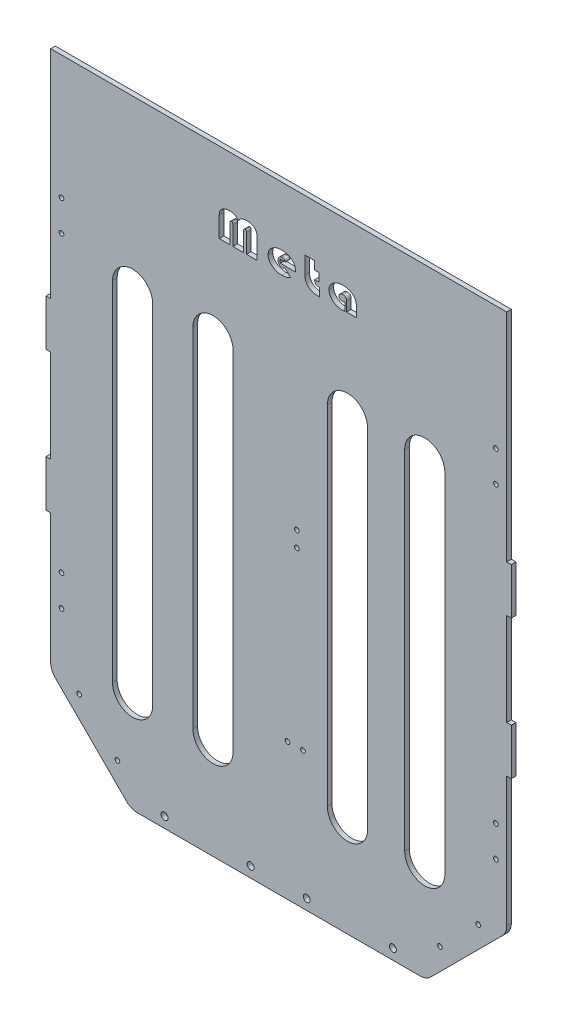
from build123d import *

# Parameters (mm, degrees)
EXTRUDE_1_DEPTH     = 3
CUT_EXTRUDE_2_DEPTH = 228.06662018
SKETCH_2_R          = 1.5
SKETCH_2_R_2        = 2.25
CUT_EXTRUDE_1_DEPTH = 10
SKETCH_4_R          = 1.5
CUT_EXTRUDE_3_DEPTH = 228.06662018
CUT_EXTRUDE_4_DEPTH = 228.06662018
FILLET_3_R          = 10
SKETCH_8_R          = 1.5
CUT_EXTRUDE_5_DEPTH = 228.06662018
SKETCH_9_W          = 295
SKETCH_9_H          = 60
EXTRUDE_2_DEPTH     = 3
SKETCH_10_R         = 1.5
CUT_EXTRUDE_6_DEPTH = 10
CUT_EXTRUDE_7_DEPTH = 10


with BuildPart() as part:
    # 草图1 → 凸台-拉伸1 (new body)
    with BuildSketch(Plane.XY):
        Polygon((-147.5, 90), (-150.5, 90), (-150.5, 60), (-147.5, 60), (-147.5, 0), (-150.5, 0), (-150.5, -30), (-147.5, -30), (-147.5, -90), (-147.5, -120), (-147.5, -170), (147.5, -170), (147.5, -120), (147.5, -90), (147.5, -30), (150.5, -30), (150.5, 0), (147.5, 0), (147.5, 60), (150.5, 60), (150.5, 90), (147.5, 90), (147.5, 170), (-147.5, 170), align=None)
    extrude(amount=EXTRUDE_1_DEPTH)

    # 草图3 → 切除-拉伸2 (cut, through all)
    with BuildSketch(Plane.XY.offset(3)):
        Polygon((-147.5, -118), (-95.5, -170), (-147.5, -170), align=None)
        Polygon((147.5, -170), (147.5, -118), (95.5, -170), align=None)
    extrude(amount=-CUT_EXTRUDE_2_DEPTH, mode=Mode.SUBTRACT)

    # 草图2 → 切除-拉伸1 (cut)
    with BuildSketch(Plane.XY.offset(3)):
        with Locations((11.800454572, 40)):
            Circle(SKETCH_2_R)
        with Locations((11.800454572, 30)):
            Circle(SKETCH_2_R)
        with Locations((-73.85, -163.15)):
            Circle(SKETCH_2_R_2)
        with Locations((-18.15, -163.15)):
            Circle(SKETCH_2_R_2)
        with Locations((18.15, -163.15)):
            Circle(SKETCH_2_R_2)
        with Locations((73.85, -163.15)):
            Circle(SKETCH_2_R_2)
    extrude(amount=-CUT_EXTRUDE_1_DEPTH, mode=Mode.SUBTRACT)

    # 草图4 → 切除-拉伸3 (cut, through all)
    with BuildSketch(Plane.XY.offset(3)):
        with Locations((140.5, 150)):
            Circle(SKETCH_4_R)
        with Locations((140.5, 130)):
            Circle(SKETCH_4_R)
        with Locations((140.5, -60)):
            Circle(SKETCH_4_R)
        with Locations((140.5, -80)):
            Circle(SKETCH_4_R)
        with Locations((-140.5, -80)):
            Circle(SKETCH_4_R)
        with Locations((-140.5, -60)):
            Circle(SKETCH_4_R)
        with Locations((-140.5, 130)):
            Circle(SKETCH_4_R)
        with Locations((-140.5, 150)):
            Circle(SKETCH_4_R)
    extrude(amount=-CUT_EXTRUDE_3_DEPTH, mode=Mode.SUBTRACT)

    # 草图5 → 切除-拉伸4 (cut, through all)
    with BuildSketch(Plane.XY.offset(3)):
        with BuildLine():
            Line((-81.5, 120), (-81.5, -105))
            ThreePointArc((-81.5, -105), (-94.5, -118), (-107.5, -105))
            Line((-107.5, -105), (-107.5, 120))
            ThreePointArc((-107.5, 120), (-94.5, 133), (-81.5, 120))
        make_face()
        with BuildLine():
            Line((-29.5, 120), (-29.5, -105))
            ThreePointArc((-29.5, -105), (-42.5, -118), (-55.5, -105))
            Line((-55.5, -105), (-55.5, 120))
            ThreePointArc((-55.5, 120), (-42.5, 133), (-29.5, 120))
        make_face()
        with BuildLine():
            Line((57.5, 120), (57.5, -105))
            ThreePointArc((57.5, -105), (44.5, -118), (31.5, -105))
            Line((31.5, -105), (31.5, 120))
            ThreePointArc((31.5, 120), (44.5, 133), (57.5, 120))
        make_face()
        with BuildLine():
            Line((107.5, 120), (107.5, -105))
            ThreePointArc((107.5, -105), (94.5, -118), (81.5, -105))
            Line((81.5, -105), (81.5, 120))
            ThreePointArc((81.5, 120), (94.5, 133), (107.5, 120))
        make_face()
    extrude(amount=-CUT_EXTRUDE_4_DEPTH, mode=Mode.SUBTRACT)

    # 圆角3
    fillet_3_edges = [part.edges().sort_by_distance(p)[0] for p in [
        (147.5, -118, 1.5),
        (95.5, -170, 1.5),
        (-95.5, -170, 1.5),
        (-147.5, -118, 1.5),
    ]]
    fillet(fillet_3_edges, radius=FILLET_3_R)

    # 草图8 → 切除-拉伸5 (cut, through all)
    with BuildSketch(Plane.XY.offset(3)):
        with Locations((-129.044105664, -122.313758713)):
            Circle(SKETCH_8_R)
        with Locations((-104.295368322, -147.062496054)):
            Circle(SKETCH_8_R)
        with Locations((104.295368322, -147.062496054)):
            Circle(SKETCH_8_R)
        with Locations((129.044105664, -122.313758713)):
            Circle(SKETCH_8_R)
    extrude(amount=-CUT_EXTRUDE_5_DEPTH, mode=Mode.SUBTRACT)

    # 草图9 → 凸台-拉伸2 (add)
    with BuildSketch(Plane.XY.offset(3)):
        with Locations((0, 200)):
            Rectangle(SKETCH_9_W, SKETCH_9_H)
    extrude(amount=-EXTRUDE_2_DEPTH)

    # 草图10 → 切除-拉伸6 (cut)
    with BuildSketch(Plane(origin=(0, 0, 0), x_dir=(-1, 0, 0), z_dir=(0, 0, -1))):
        with Locations((-15.714480525, -81.497694715)):
            Circle(SKETCH_10_R)
        with Locations((-5.714480525, -81.497694715)):
            Circle(SKETCH_10_R)
    extrude(amount=-CUT_EXTRUDE_6_DEPTH, mode=Mode.SUBTRACT)

    # 草图12 → 切除-拉伸7 (cut)
    with BuildSketch(Plane.XY.offset(3)):
        with BuildLine():
            Line((-38.459270455, 178.142606867), (-38.459270455, 191.48003622))
            add(Edge.make_bspline(
                [(-38.459270455, 191.48003622), (-38.455033411, 191.681058058), (-38.446709584, 192.075972675), (-38.346599974, 192.652647807), (-38.208715022, 193.205847545), (-37.99443122, 193.725817353), (-37.730436968, 194.22146777), (-37.396648893, 194.680992182), (-37.014003649, 195.120623841), (-36.567844802, 195.521180351), (-36.079300876, 195.888824271), (-35.54992644, 196.206329747), (-34.989033735, 196.477067178), (-34.392513082, 196.697756907), (-33.761395822, 196.869228712), (-33.096340243, 196.994280016), (-32.397190688, 197.066282213), (-31.919749742, 197.07520164), (-31.676234956, 197.07975092)],
                knots=[0, 0, 0, 0, 0.978236146, 1.921780028, 2.844563154, 3.750638742, 4.654252005, 5.574363863, 6.511385916, 7.48903622, 8.489661905, 9.486229015, 10.491445866, 11.520012641, 12.580453885, 13.674150294, 14.813719686, 16, 16, 16, 16], degree=3))
            add(Edge.make_bspline(
                [(-31.676234956, 197.07975092), (-31.385549048, 197.073097088), (-30.820070313, 197.06015322), (-29.99936011, 196.929275852), (-29.228647015, 196.734183589), (-28.5105693, 196.4454009), (-27.844924771, 196.074455011), (-27.231400107, 195.622132358), (-26.670586716, 195.087898147), (-26.348532633, 194.679853549), (-26.184824194, 194.472433903)],
                knots=[0, 0, 0, 0, 1.102097073, 2.143937636, 3.145610596, 4.113155461, 5.071599259, 6.029492362, 6.998339889, 8, 8, 8, 8], degree=3))
            add(Edge.make_bspline(
                [(-26.184824194, 194.472433903), (-26.009496825, 194.688435518), (-25.666410016, 195.111115131), (-25.074517517, 195.652462415), (-24.448746168, 196.10982807), (-23.770022718, 196.473582165), (-23.028307523, 196.746635702), (-22.214259021, 196.942877484), (-21.321099271, 197.0576227), (-20.699104066, 197.072193956), (-20.376524133, 197.07975092)],
                knots=[0, 0, 0, 0, 1.006073283, 1.968719849, 2.894482347, 3.806317825, 4.746885426, 5.748441048, 6.832293675, 8, 8, 8, 8], degree=3))
            add(Edge.make_bspline(
                [(-20.376524133, 197.07975092), (-20.123647833, 197.07530343), (-19.631518827, 197.066648057), (-18.915021362, 196.994629219), (-18.244107006, 196.871219331), (-17.618314213, 196.698736696), (-17.038228497, 196.479322271), (-16.504642257, 196.208600824), (-16.014321938, 195.890905499), (-15.573399332, 195.519869728), (-15.176511521, 195.107082453), (-14.838764322, 194.643329349), (-14.547595573, 194.141770012), (-14.315375964, 193.592327554), (-14.128889326, 193.001946764), (-14.005801719, 192.36516806), (-13.920492779, 191.686920679), (-13.913819056, 191.21959361), (-13.910377932, 190.978629101)],
                knots=[0, 0, 0, 0, 1.196672597, 2.328875015, 3.403774161, 4.42172451, 5.397224268, 6.33402178, 7.248515767, 8.15601989, 9.055745737, 9.951881185, 10.864775314, 11.79462141, 12.769381904, 13.789572317, 14.860253008, 16, 16, 16, 16], degree=3))
            Line((-13.910377932, 190.978629101), (-13.910377932, 178.142606867))
            Line((-13.910377932, 178.142606867), (-20.829796168, 178.142606867))
            Line((-20.829796168, 178.142606867), (-20.829796168, 190.176377712))
            add(Edge.make_bspline(
                [(-20.829796168, 190.176377712), (-20.832218182, 190.300761455), (-20.836681157, 190.529959794), (-20.865105905, 190.844941034), (-20.92112314, 191.100630773), (-20.992727215, 191.306747428), (-21.108032251, 191.465049964), (-21.268895249, 191.570688481), (-21.470616508, 191.637395796), (-21.619396243, 191.641997383), (-21.700238926, 191.644497755)],
                knots=[0, 0, 0, 0, 1.51792738, 2.79704103, 3.849850316, 4.7071922, 5.441291345, 6.192412743, 7.017808414, 8, 8, 8, 8], degree=3))
            add(Edge.make_bspline(
                [(-21.700238926, 191.644497755), (-21.782353073, 191.641809977), (-21.939142146, 191.636677923), (-22.156487997, 191.566239929), (-22.33931983, 191.453623681), (-22.494902495, 191.301842025), (-22.603414675, 191.097426259), (-22.69003804, 190.857700929), (-22.735018452, 190.572420639), (-22.740332622, 190.369040765), (-22.743165732, 190.260614108)],
                knots=[0, 0, 0, 0, 0.995205846, 1.900249939, 2.739666704, 3.590502501, 4.508166618, 5.526483225, 6.681309272, 8, 8, 8, 8], degree=3))
            Line((-22.743165732, 190.260614108), (-22.743165732, 178.142606867))
            Line((-22.743165732, 178.142606867), (-29.626482655, 178.142606867))
            Line((-29.626482655, 178.142606867), (-29.626482655, 190.176377712))
            add(Edge.make_bspline(
                [(-29.626482655, 190.176377712), (-29.628871414, 190.296769977), (-29.633287366, 190.519331765), (-29.662498612, 190.82739981), (-29.718086281, 191.082013607), (-29.790903541, 191.290483694), (-29.903421743, 191.459303522), (-30.075245846, 191.566869256), (-30.286817063, 191.63838494), (-30.444052598, 191.642353388), (-30.529015469, 191.644497755)],
                knots=[0, 0, 0, 0, 1.451462248, 2.683229115, 3.723459649, 4.585606057, 5.336972781, 6.114842452, 6.981347338, 8, 8, 8, 8], degree=3))
            add(Edge.make_bspline(
                [(-30.529015469, 191.644497755), (-30.608533781, 191.64022426), (-30.760134601, 191.632076888), (-30.971623219, 191.560434645), (-31.155274513, 191.447742079), (-31.298121233, 191.277047854), (-31.411515054, 191.065942031), (-31.483286247, 190.807139024), (-31.53288485, 190.507212659), (-31.537425211, 190.291620536), (-31.53985222, 190.176377712)],
                knots=[0, 0, 0, 0, 0.940798576, 1.793622527, 2.620983287, 3.464162116, 4.401073909, 5.444963136, 6.634228101, 8, 8, 8, 8], degree=3))
            Line((-31.53985222, 190.176377712), (-31.53985222, 178.142606867))
            Line((-31.53985222, 178.142606867), (-38.459270455, 178.142606867))
        make_face()
        with BuildLine():
            Line((10.734784758, 184.103334692), (1.103756825, 184.103334692))
            add(Edge.make_bspline(
                [(1.103756825, 184.103334692), (1.033567019, 184.28570241), (0.895771868, 184.643722875), (0.873841118, 185.026603282), (0.863081408, 185.214452867)],
                knots=[0, 0, 0, 0, 1.018755826, 2, 2, 2, 2], degree=3))
            add(Edge.make_bspline(
                [(0.863081408, 185.214452867), (0.867020867, 185.317710925), (0.875065676, 185.528575206), (0.939937842, 185.845419118), (1.034879003, 186.170330206), (1.127987471, 186.381323284), (1.17595945, 186.490032576)],
                knots=[0, 0, 0, 0, 0.935680566, 1.910762352, 2.923568736, 4, 4, 4, 4], degree=3))
            Line((1.17595945, 186.490032576), (4.40903255, 186.490032576))
            add(Edge.make_bspline(
                [(4.40903255, 186.490032576), (4.379994244, 186.610498606), (4.324121546, 186.842287681), (4.171157001, 187.157397132), (3.974707816, 187.426739924), (3.725502588, 187.644119928), (3.432603622, 187.816197993), (3.089036299, 187.928130213), (2.703472325, 188.002976667), (2.430551696, 188.010405098), (2.287077625, 188.014310217)],
                knots=[0, 0, 0, 0, 1.032600104, 1.986829189, 2.905008873, 3.799231914, 4.730298252, 5.722915435, 6.802939171, 8, 8, 8, 8], degree=3))
            add(Edge.make_bspline(
                [(2.287077625, 188.014310217), (2.102841006, 188.004309983), (1.744079765, 187.984836676), (1.228792549, 187.831108161), (0.763495866, 187.57400253), (0.360541365, 187.217873486), (0.023360862, 186.789426315), (-0.214586267, 186.287683856), (-0.36407772, 185.728416025), (-0.380116372, 185.334448194), (-0.38843076, 185.130216471)],
                knots=[0, 0, 0, 0, 1.003352735, 1.953813929, 2.903463803, 3.880157341, 4.867487872, 5.855544986, 6.888321052, 8, 8, 8, 8], degree=3))
            add(Edge.make_bspline(
                [(-0.38843076, 185.130216471), (-0.381548459, 184.921983889), (-0.368231671, 184.519067849), (-0.220294667, 183.946312068), (0.002697873, 183.424171714), (0.273450006, 183.045892005), (0.525336039, 182.780774821), (0.730740292, 182.610656952), (0.942719735, 182.456924303), (1.174921704, 182.342781536), (1.417585579, 182.248684416), (1.673080959, 182.181348473), (1.942046639, 182.139262938), (2.125129518, 182.135655103), (2.218886256, 182.133807531)],
                knots=[0, 0, 0, 0, 1.682300669, 3.255138644, 4.757815252, 6.256743169, 6.99181788, 7.714023768, 8.413809748, 9.106186813, 9.80185711, 10.518769058, 11.241461663, 12, 12, 12, 12], degree=3))
            add(Edge.make_bspline(
                [(2.218886256, 182.133807531), (2.379221698, 182.142819521), (2.704058408, 182.161077652), (3.177410779, 182.32130588), (3.641972272, 182.563337686), (3.916891781, 182.792603593), (4.060053196, 182.911991379)],
                knots=[0, 0, 0, 0, 0.939410788, 1.903229289, 2.908128919, 4, 4, 4, 4], degree=3))
            Line((4.060053196, 182.911991379), (7.678206963, 179.418186577))
            add(Edge.make_bspline(
                [(7.678206963, 179.418186577), (7.467308981, 179.29210475), (7.047952024, 179.041399218), (6.389257308, 178.720237532), (5.712777007, 178.44645517), (5.014242628, 178.227828043), (4.300308464, 178.04633274), (3.56407752, 177.932037365), (2.810412846, 177.849440111), (2.300685878, 177.841682413), (2.042390951, 177.837751339)],
                knots=[0, 0, 0, 0, 0.993749789, 1.976006989, 2.961476618, 3.943510341, 4.935417873, 5.938605361, 6.95542553, 8, 8, 8, 8], degree=3))
            add(Edge.make_bspline(
                [(2.042390951, 177.837751339), (1.738584123, 177.843588191), (1.140105476, 177.85508639), (0.260903717, 177.95565816), (-0.58564139, 178.107590854), (-1.393349226, 178.335870055), (-2.168881585, 178.618099678), (-2.904463359, 178.975786528), (-3.609536209, 179.388426691), (-4.270665778, 179.861945745), (-4.872054854, 180.384481685), (-5.407040088, 180.937101634), (-5.855538948, 181.525499891), (-6.21876182, 182.144972156), (-6.507740924, 182.791117046), (-6.713180963, 183.469948005), (-6.836063698, 184.180419147), (-6.85101483, 184.66442677), (-6.858588217, 184.909597339)],
                knots=[0, 0, 0, 0, 1.154104094, 2.273506035, 3.358761524, 4.418939653, 5.459057417, 6.490801668, 7.522558431, 8.560340411, 9.576058527, 10.546357483, 11.478233679, 12.38015136, 13.269559415, 14.161633932, 15.068788935, 16, 16, 16, 16], degree=3))
            add(Edge.make_bspline(
                [(-6.858588217, 184.909597339), (-6.851139489, 185.152132739), (-6.836435518, 185.630903523), (-6.711610562, 186.333818162), (-6.512111198, 187.007942647), (-6.226124507, 187.651751778), (-5.864837565, 188.269323073), (-5.414779349, 188.851472348), (-4.887342399, 189.404300735), (-4.290528504, 189.924721331), (-3.632467908, 190.401038747), (-2.924162874, 190.810848402), (-2.182922609, 191.170944162), (-1.397058448, 191.450855229), (-0.575065449, 191.680694666), (0.287844617, 191.830865084), (1.188240445, 191.932570938), (1.801417959, 191.943679614), (2.114593576, 191.949353283)],
                knots=[0, 0, 0, 0, 0.917462039, 1.811092393, 2.693371349, 3.572625705, 4.471015947, 5.39522366, 6.351081228, 7.359009312, 8.38862332, 9.420709752, 10.452982308, 11.503286222, 12.573952047, 13.67985295, 14.815003053, 16, 16, 16, 16], degree=3))
            add(Edge.make_bspline(
                [(2.114593576, 191.949353283), (2.413016783, 191.943171643), (2.999283313, 191.93102752), (3.861363209, 191.835823509), (4.689612083, 191.685883553), (5.48210712, 191.469868701), (6.236698972, 191.186249686), (6.957127269, 190.843964278), (7.645850792, 190.444151622), (8.286130806, 189.979591571), (8.874399385, 189.475354951), (9.390501055, 188.93326316), (9.828419277, 188.359268437), (10.188017643, 187.755568538), (10.467379886, 187.121122526), (10.665047341, 186.45696591), (10.783872311, 185.761578959), (10.799198106, 185.287121346), (10.806987383, 185.045980075)],
                knots=[0, 0, 0, 0, 1.160333119, 2.279529394, 3.368790135, 4.430966698, 5.469250821, 6.499653248, 7.529727603, 8.561585411, 9.571740327, 10.539111335, 11.466802064, 12.373756115, 13.265512144, 14.155553358, 15.062567033, 16, 16, 16, 16], degree=3))
            add(Edge.make_bspline(
                [(10.806987383, 185.045980075), (10.805757983, 185.012548107), (10.80216542, 184.914852904), (10.789711094, 184.72352248), (10.763926251, 184.442977373), (10.745340254, 184.226358485), (10.734784758, 184.103334692)],
                knots=[0, 0, 0, 0, 0.424575904, 1.240699609, 2.43291782, 4, 4, 4, 4], degree=3))
        make_face()
        with BuildLine():
            Line((23.302052776, 196.634501398), (23.302052776, 191.339642227))
            Line((23.302052776, 191.339642227), (26.154056466, 191.339642227))
            Line((26.154056466, 191.339642227), (26.154056466, 185.988625458))
            Line((26.154056466, 185.988625458), (23.302052776, 185.988625458))
            add(Edge.make_bspline(
                [(23.302052776, 185.988625458), (23.302676145, 185.86016815), (23.303879633, 185.612166009), (23.338675734, 185.25618393), (23.384015338, 184.929925918), (23.451950808, 184.635840529), (23.538686637, 184.372774444), (23.649148701, 184.142858434), (23.771004772, 183.937448871), (23.924520518, 183.76688753), (24.099948214, 183.616088257), (24.314767783, 183.499952661), (24.553697021, 183.388120403), (24.831664641, 183.30781928), (25.139143066, 183.2371329), (25.483584423, 183.198811382), (25.859127699, 183.161990174), (26.121850226, 183.161134092), (26.258349147, 183.160689309)],
                knots=[0, 0, 0, 0, 1.277388559, 2.466150854, 3.555474554, 4.552596853, 5.46549412, 6.304548195, 7.087181564, 7.831806814, 8.577856731, 9.376494698, 10.251783464, 11.198559564, 12.247577516, 13.387782732, 14.642808274, 16, 16, 16, 16], degree=3))
            Line((26.258349147, 183.160689309), (26.258349147, 177.837751339))
            add(Edge.make_bspline(
                [(26.258349147, 177.837751339), (25.902451033, 177.843729364), (25.21080144, 177.85534701), (24.203335748, 177.95050941), (23.253771848, 178.097098894), (22.366016703, 178.321283953), (21.533986816, 178.59414004), (20.764376476, 178.938505499), (20.050015166, 179.33725223), (19.403081104, 179.804817579), (18.822075887, 180.325811782), (18.318680876, 180.903316083), (17.886314877, 181.529238238), (17.544078088, 182.21346556), (17.266267356, 182.944648075), (17.076865497, 183.73032621), (16.963681125, 184.566667744), (16.948163265, 185.140547772), (16.940199256, 185.435071999)],
                knots=[0, 0, 0, 0, 1.253578291, 2.43619418, 3.562207737, 4.634998139, 5.658363466, 6.643154378, 7.60079145, 8.53554003, 9.449390693, 10.344076715, 11.228623511, 12.121857471, 13.032655734, 13.97863633, 14.962604474, 16, 16, 16, 16], degree=3))
            Line((16.940199256, 185.435071999), (16.940199256, 196.634501398))
            Line((16.940199256, 196.634501398), (23.302052776, 196.634501398))
        make_face()
        with BuildLine():
            Line((42.909076739, 183.160689309), (42.909076739, 177.950066534))
            add(Edge.make_bspline(
                [(42.909076739, 177.950066534), (42.675457841, 177.917309033), (42.203076528, 177.85107282), (41.72614355, 177.84222395), (41.485080523, 177.837751339)],
                knots=[0, 0, 0, 0, 0.989111517, 2, 2, 2, 2], degree=3))
            add(Edge.make_bspline(
                [(41.485080523, 177.837751339), (41.173261624, 177.843588189), (40.560130153, 177.855065225), (39.662123904, 177.954960231), (38.801043911, 178.107729374), (37.982432106, 178.335238955), (37.198708019, 178.617310717), (36.459054042, 178.975104666), (35.75409638, 179.386313364), (35.099700013, 179.862253855), (34.506333682, 180.384609815), (33.978508076, 180.936917114), (33.540256105, 181.528214621), (33.173786989, 182.142772558), (32.895864677, 182.7925238), (32.694002739, 183.470425296), (32.570352818, 184.180394032), (32.555515685, 184.664418326), (32.548000042, 184.909597339)],
                knots=[0, 0, 0, 0, 1.179780145, 2.319809157, 3.415604472, 4.486126351, 5.531535423, 6.563669194, 7.591252538, 8.616628021, 9.620614587, 10.580020798, 11.502037403, 12.40030686, 13.282060698, 14.169070055, 15.072555649, 16, 16, 16, 16], degree=3))
            add(Edge.make_bspline(
                [(32.548000042, 184.909597339), (32.555533223, 185.148101986), (32.570402296, 185.618865015), (32.694284078, 186.311898359), (32.900613219, 186.978079416), (33.186677398, 187.617475558), (33.552228728, 188.230411734), (34.001869294, 188.814516823), (34.533963166, 189.370927465), (35.137068542, 189.896650747), (35.7949448, 190.377871195), (36.497960903, 190.795170024), (37.228443978, 191.155962615), (37.996860021, 191.443435139), (38.795434296, 191.674653566), (39.6295565, 191.832321186), (40.494551927, 191.931760768), (41.082340682, 191.94342886), (41.380787842, 191.949353283)],
                knots=[0, 0, 0, 0, 0.914085472, 1.804231707, 2.689714318, 3.582529265, 4.483828075, 5.42010518, 6.402942539, 7.431267925, 8.484498161, 9.523846605, 10.562600489, 11.604374252, 12.665722588, 13.746692307, 14.855892909, 16, 16, 16, 16], degree=3))
            add(Edge.make_bspline(
                [(41.380787842, 191.949353283), (41.713969915, 191.945007112), (42.364309838, 191.936523798), (43.311539776, 191.840286705), (44.20635001, 191.69492213), (45.046813282, 191.487351444), (45.833605003, 191.218000087), (46.566799012, 190.889834425), (47.245111197, 190.498108192), (47.867246824, 190.05037072), (48.423880934, 189.54876774), (48.916626698, 189.005582143), (49.326218114, 188.410214389), (49.668246636, 187.774340554), (49.921654589, 187.089555786), (50.11334406, 186.36633027), (50.226816889, 185.596435014), (50.239286442, 185.067750176), (50.245665697, 184.797282144)],
                knots=[0, 0, 0, 0, 1.243628319, 2.427444964, 3.5510723, 4.626319921, 5.655723549, 6.652328348, 7.620838395, 8.575558905, 9.508852846, 10.413945699, 11.307216005, 12.200583967, 13.102794417, 14.026747668, 14.990510721, 16, 16, 16, 16], degree=3))
            Line((50.245665697, 184.797282144), (50.245665697, 178.142606867))
            Line((50.245665697, 178.142606867), (43.883812178, 178.142606867))
            Line((43.883812178, 178.142606867), (43.883812178, 184.436269019))
            add(Edge.make_bspline(
                [(43.883812178, 184.436269019), (43.87729152, 184.60825897), (43.864819787, 184.937215444), (43.737254904, 185.402508045), (43.524945941, 185.808826281), (43.232610351, 186.153661146), (42.87229876, 186.426537186), (42.457556672, 186.628581667), (41.987378598, 186.745023599), (41.656879835, 186.759358014), (41.485080523, 186.766809306)],
                knots=[0, 0, 0, 0, 1.092634786, 2.089827252, 3.041495474, 3.989503715, 4.942692782, 5.898044871, 6.907365214, 8, 8, 8, 8], degree=3))
            add(Edge.make_bspline(
                [(41.485080523, 186.766809306), (41.322614358, 186.76049726), (41.004265738, 186.748128956), (40.544673401, 186.632280132), (40.121225276, 186.441260151), (39.744611339, 186.181185475), (39.422835688, 185.877198446), (39.192493192, 185.5249064), (39.040438353, 185.144817332), (39.025614971, 184.876241786), (39.018157499, 184.741124547)],
                knots=[0, 0, 0, 0, 1.102438086, 2.16020145, 3.197155871, 4.243028364, 5.258219183, 6.183069902, 7.085923562, 8, 8, 8, 8], degree=3))
            add(Edge.make_bspline(
                [(39.018157499, 184.741124547), (39.024978579, 184.607644156), (39.038324975, 184.346471083), (39.170443282, 183.975893431), (39.380196412, 183.642003992), (39.672866887, 183.354719983), (40.030283413, 183.117028127), (40.448304444, 182.949964318), (40.915347527, 182.841630092), (41.245088285, 182.83250784), (41.416889154, 182.827754983)],
                knots=[0, 0, 0, 0, 0.93051156, 1.820676136, 2.71578815, 3.667991569, 4.66654834, 5.698102044, 6.800669741, 8, 8, 8, 8], degree=3))
            add(Edge.make_bspline(
                [(41.416889154, 182.827754983), (41.548221143, 182.831146116), (41.808490059, 182.837866539), (42.190212561, 182.905561278), (42.559723073, 183.008053725), (42.792446634, 183.109732626), (42.909076739, 183.160689309)],
                knots=[0, 0, 0, 0, 1.0216669, 2.024701966, 3.010073512, 4, 4, 4, 4], degree=3))
        make_face()
    extrude(amount=-CUT_EXTRUDE_7_DEPTH, mode=Mode.SUBTRACT)


solid = part.part
